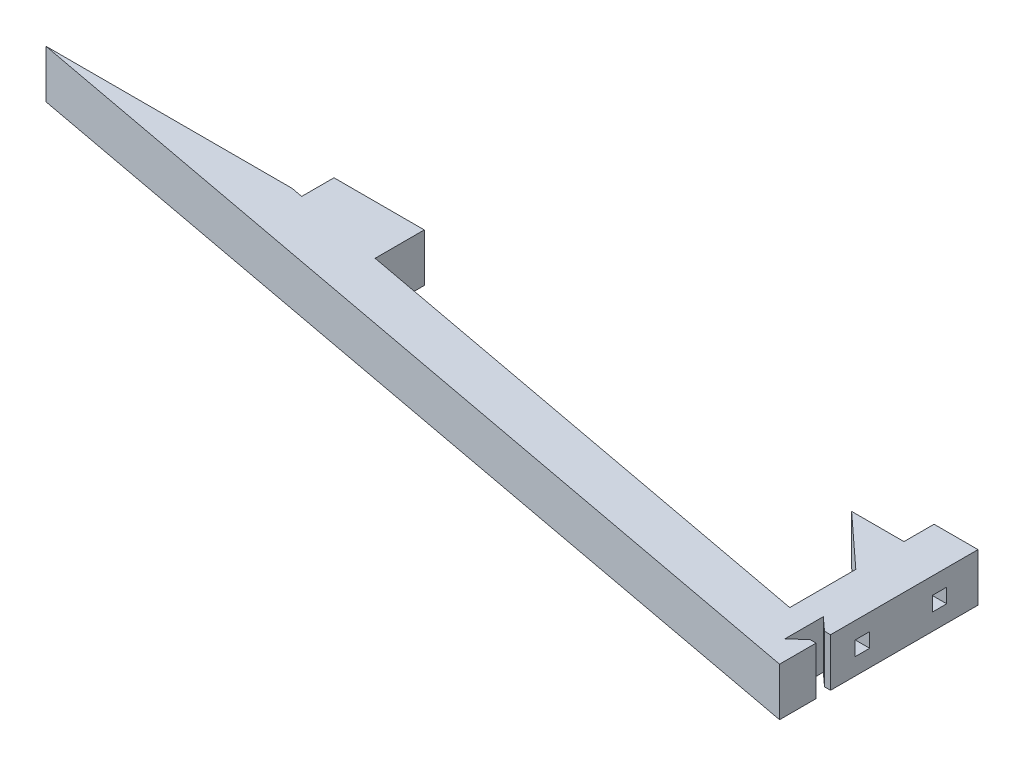
from build123d import *

# Parameters (mm, degrees)
P_IDAT_VYSUNUT_M1_DEPTH  = 8
ODEBRAT_VYSUNUT_M1_DEPTH = 154.64258329
SKICA5_W                 = 16
SKICA5_H                 = 8
P_IDAT_VYSUNUT_M2_DEPTH  = 8
ODEBRAT_VYSUNUT_M4_DEPTH = 154.64258329
SKICA4_W                 = 2.4
SKICA4_H                 = 2.4
ODEBRAT_VYSUNUT_M2_DEPTH = 4.4


with BuildPart() as part:
    # Skica2 → Přidat vysunutím1 (new body)
    with BuildSketch(Plane(origin=(0, 0, 0), x_dir=(1, 0, 0), z_dir=(0, 1, 0))):
        Polygon((0, 0), (0, -32.97), (-149.85, -5), (-108.974598174, -5), (-107, -5.368565305), (-107, 0), (-92, 0), (-92, -8.168365105), (-7.3, -23.977901307), (-7.3, 0), align=None)
    extrude(amount=P_IDAT_VYSUNUT_M1_DEPTH)

    # Skica3 → Odebrat vysunutím1 (cut, through all)
    with BuildSketch(Plane(origin=(0, 8, 0), x_dir=(1, 0, 0), z_dir=(0, 1, 0))):
        Polygon((0, -24.5), (-1, -24.5), (-3.2, -22.5), (-3.2, -28.9), (-1, -26.9), (0, -26.9), align=None)
    extrude(amount=-ODEBRAT_VYSUNUT_M1_DEPTH, mode=Mode.SUBTRACT)

    # Skica5 → Přidat vysunutím2 (add)
    with BuildSketch(Plane(origin=(0, 8, 0), x_dir=(1, 0, 0), z_dir=(0, 1, 0))):
        with Locations((-8, -9)):
            Rectangle(SKICA5_W, SKICA5_H)
    extrude(amount=-P_IDAT_VYSUNUT_M2_DEPTH)

    # Skica7 → Odebrat vysunutím4 (cut, through all)
    with BuildSketch(Plane.XZ):
        Polygon((-16, 5), (-16, 13), (-7.3, 13), align=None)
    extrude(amount=-ODEBRAT_VYSUNUT_M4_DEPTH, mode=Mode.SUBTRACT)

    # Skica4 → Odebrat vysunutím2 (cut)
    with BuildSketch(Plane(origin=(0, 0, 0), x_dir=(0, 0, -1), z_dir=(1, 0, 0))):
        with Locations((-19.2, 4)):
            Rectangle(SKICA4_W, SKICA4_H)
        with Locations((-6.4, 4)):
            Rectangle(SKICA4_W, SKICA4_H)
    extrude(amount=-ODEBRAT_VYSUNUT_M2_DEPTH, mode=Mode.SUBTRACT)


solid = part.part
